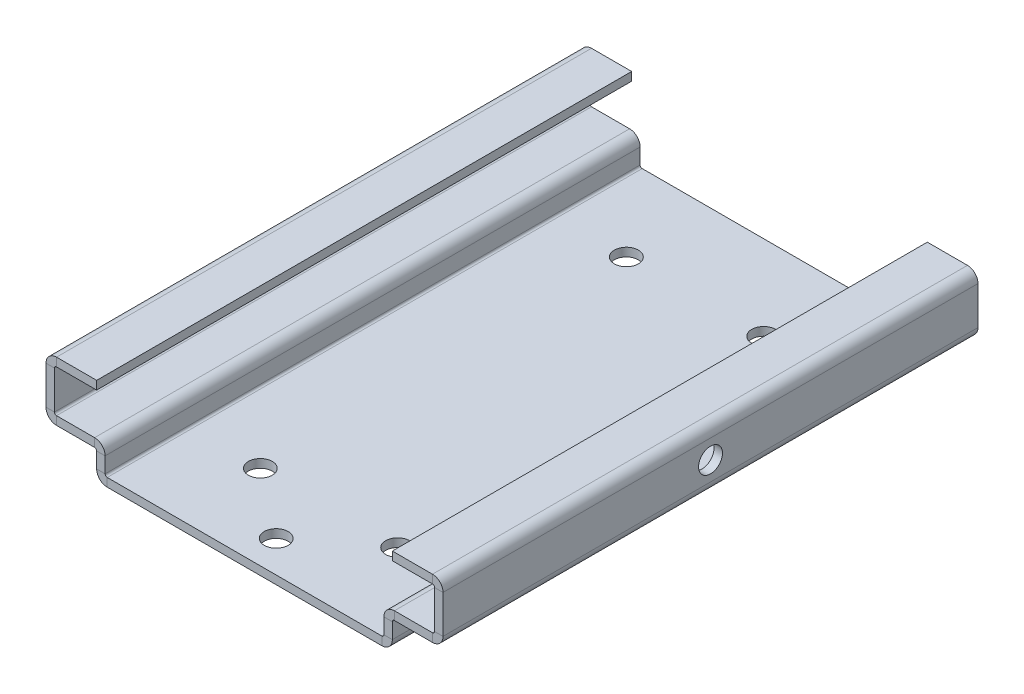
from build123d import *

# Parameters (mm, degrees)
SKETCH1_W                       = 105
SKETCH1_H                       = 190
BASE_FLANGE1_DEPTH              = 3
EDGE_FLANGE1_STRIP_W            = 13.4732
EDGE_FLANGE1_STRIP_H            = 3
EDGE_FLANGE1_STRIP_CUT_DEPTH    = 190
EDGE_FLANGE1_STRIP_2_W          = 13.4732
EDGE_FLANGE1_STRIP_2_H          = 3
EDGE_FLANGE1_STRIP_CUT_2_DEPTH  = 190
EDGE_FLANGE1_DEPTH              = 190
EDGE_FLANGE1_BEND_DEPTH         = 190
SKETCH33_R                      = 4.25
CUT_EXTRUDE1_DEPTH              = 10
EDGE_FLANGE8_STRIP_W            = 13.4732
EDGE_FLANGE8_STRIP_H            = 3
EDGE_FLANGE8_STRIP_CUT_DEPTH    = 190
EDGE_FLANGE8_STRIP_2_W          = 13.4732
EDGE_FLANGE8_STRIP_2_H          = 3
EDGE_FLANGE8_STRIP_CUT_2_DEPTH  = 190
EDGE_FLANGE8_DEPTH              = 190
EDGE_FLANGE8_BEND_DEPTH         = 190
EDGE_FLANGE9_STRIP_W            = 13.4732
EDGE_FLANGE9_STRIP_H            = 3
EDGE_FLANGE9_STRIP_CUT_DEPTH    = 190
EDGE_FLANGE9_STRIP_2_W          = 13.4732
EDGE_FLANGE9_STRIP_2_H          = 3
EDGE_FLANGE9_STRIP_CUT_2_DEPTH  = 190
EDGE_FLANGE9_DEPTH              = 190
EDGE_FLANGE9_BEND_DEPTH         = 190
EDGE_FLANGE10_STRIP_W           = 13.4732
EDGE_FLANGE10_STRIP_H           = 3
EDGE_FLANGE10_STRIP_CUT_DEPTH   = 190
EDGE_FLANGE10_STRIP_2_W         = 13.4732
EDGE_FLANGE10_STRIP_2_H         = 3
EDGE_FLANGE10_STRIP_CUT_2_DEPTH = 190
EDGE_FLANGE10_DEPTH             = 190
EDGE_FLANGE10_BEND_DEPTH        = 190
SKETCH72_R                      = 4.25
CUT_EXTRUDE4_DEPTH              = 10
CUT_EXTRUDE5_START              = -10
SKETCH77_R                      = 4.25
CUT_EXTRUDE5_DEPTH              = 10
SKETCH78_R                      = 4.25
CUT_EXTRUDE8_DEPTH              = 10


# Sheet-metal steps are written as plain solids
with BuildPart() as part:
    # Sketch1 → Base-Flange1 (new body)
    with BuildSketch(Plane(origin=(0, 0, 0), x_dir=(1, 0, 0), z_dir=(0, 1, 0))):
        Rectangle(SKETCH1_W, SKETCH1_H)
    extrude(amount=-BASE_FLANGE1_DEPTH)

    # Edge-Flange1 strip (across the edge) → Edge-Flange1 strip cut (cut)
    with BuildSketch(Plane(origin=(52.5, 0, 95), x_dir=(-1, 0, 0), z_dir=(0, 0, -1))):
        with Locations((-3, -1.5)):
            Rectangle(EDGE_FLANGE1_STRIP_W, EDGE_FLANGE1_STRIP_H)
    extrude(amount=EDGE_FLANGE1_STRIP_CUT_DEPTH, mode=Mode.SUBTRACT)

    # Edge-Flange1 strip 2 (across the edge) → Edge-Flange1 strip cut 2 (cut)
    with BuildSketch(Plane(origin=(-52.5, 0, -95), x_dir=(1, 0, 0), z_dir=(0, 0, 1))):
        with Locations((-3, -1.5)):
            Rectangle(EDGE_FLANGE1_STRIP_2_W, EDGE_FLANGE1_STRIP_2_H)
    extrude(amount=EDGE_FLANGE1_STRIP_CUT_2_DEPTH, mode=Mode.SUBTRACT)

    # Edge-Flange1 section (across the edge) → Edge-Flange1 (add)
    with BuildSketch(Plane(origin=(52.5, 0, 95), x_dir=(-1, 0, 0), z_dir=(0, 0, -1))):
        with BuildLine():
            Line((0, 0.7366), (0, 7))
            Line((0, 7), (3, 7))
            Line((3, 7), (3, 0.7366))
            ThreePointArc((3, 0.7366), (3.215745145, 0.215745145), (3.7366, 0))
            Line((3.7366, 0), (3.7366, -3))
            ThreePointArc((3.7366, -3), (1.094424801, -1.905575199), (0, 0.7366))
        make_face()
    extrude(amount=EDGE_FLANGE1_DEPTH)

    # Edge-Flange1 section 2 (across the edge) → Edge-Flange1 bend (add)
    with BuildSketch(Plane(origin=(-52.5, 0, -95), x_dir=(1, 0, 0), z_dir=(0, 0, 1))):
        with BuildLine():
            Line((0, 0.7366), (0, 7))
            Line((0, 7), (3, 7))
            Line((3, 7), (3, 0.7366))
            ThreePointArc((3, 0.7366), (3.215745145, 0.215745145), (3.7366, 0))
            Line((3.7366, 0), (3.7366, -3))
            ThreePointArc((3.7366, -3), (1.094424801, -1.905575199), (0, 0.7366))
        make_face()
    extrude(amount=EDGE_FLANGE1_BEND_DEPTH)

    # Sketch33 → Cut-Extrude1 (cut)
    with BuildSketch(Plane(origin=(0, 0, 0), x_dir=(1, 0, 0), z_dir=(0, 1, 0))):
        with Locations(Location((24.3834, -65, 0), (0, 0, 270))):
            Circle(SKETCH33_R)
        with Locations(Location((24.3834, 65, 0), (0, 0, 270))):
            Circle(SKETCH33_R)
        with Locations(Location((-24.3834, 65, 0), (0, 0, 270))):
            Circle(SKETCH33_R)
        with Locations(Location((-24.3834, -65, 0), (0, 0, 270))):
            Circle(SKETCH33_R)
    extrude(amount=-CUT_EXTRUDE1_DEPTH, mode=Mode.SUBTRACT)

    # Edge-Flange8 strip (across the edge) → Edge-Flange8 strip cut (cut)
    with BuildSketch(Plane(origin=(-52.5, 7, 95), x_dir=(0, -1, 0), z_dir=(0, 0, -1))):
        with Locations((-6, -1.5)):
            Rectangle(EDGE_FLANGE8_STRIP_W, EDGE_FLANGE8_STRIP_H)
    extrude(amount=EDGE_FLANGE8_STRIP_CUT_DEPTH, mode=Mode.SUBTRACT)

    # Edge-Flange8 strip 2 (across the edge) → Edge-Flange8 strip cut 2 (cut)
    with BuildSketch(Plane(origin=(52.5, 7, -95), x_dir=(0, -1, 0), z_dir=(0, 0, 1))):
        with Locations((-6, -1.5)):
            Rectangle(EDGE_FLANGE8_STRIP_2_W, EDGE_FLANGE8_STRIP_2_H)
    extrude(amount=EDGE_FLANGE8_STRIP_CUT_2_DEPTH, mode=Mode.SUBTRACT)

    # Edge-Flange8 section (across the edge) → Edge-Flange8 (add)
    with BuildSketch(Plane(origin=(-52.5, 7, 95), x_dir=(0, -1, 0), z_dir=(0, 0, -1))):
        with BuildLine():
            Line((-3, 0.7366), (-3, 15))
            Line((-3, 15), (0, 15))
            Line((0, 15), (0, 0.7366))
            ThreePointArc((0, 0.7366), (0.215745145, 0.215745145), (0.7366, 0))
            Line((0.7366, 0), (0.7366, -3))
            ThreePointArc((0.7366, -3), (-1.905575199, -1.905575199), (-3, 0.7366))
        make_face()
    extrude(amount=EDGE_FLANGE8_DEPTH)

    # Edge-Flange8 section 2 (across the edge) → Edge-Flange8 bend (add)
    with BuildSketch(Plane(origin=(52.5, 7, -95), x_dir=(0, -1, 0), z_dir=(0, 0, 1))):
        with BuildLine():
            Line((-3, 0.7366), (-3, 15))
            Line((-3, 15), (0, 15))
            Line((0, 15), (0, 0.7366))
            ThreePointArc((0, 0.7366), (0.215745145, 0.215745145), (0.7366, 0))
            Line((0.7366, 0), (0.7366, -3))
            ThreePointArc((0.7366, -3), (-1.905575199, -1.905575199), (-3, 0.7366))
        make_face()
    extrude(amount=EDGE_FLANGE8_BEND_DEPTH)

    # Edge-Flange9 strip (across the edge) → Edge-Flange9 strip cut (cut)
    with BuildSketch(Plane(origin=(-67.5, 10, -95), x_dir=(1, 0, 0), z_dir=(0, 0, 1))):
        with Locations((-6, -1.5)):
            Rectangle(EDGE_FLANGE9_STRIP_W, EDGE_FLANGE9_STRIP_H)
    extrude(amount=EDGE_FLANGE9_STRIP_CUT_DEPTH, mode=Mode.SUBTRACT)

    # Edge-Flange9 strip 2 (across the edge) → Edge-Flange9 strip cut 2 (cut)
    with BuildSketch(Plane(origin=(67.5, 10, 95), x_dir=(-1, 0, 0), z_dir=(0, 0, -1))):
        with Locations((-6, -1.5)):
            Rectangle(EDGE_FLANGE9_STRIP_2_W, EDGE_FLANGE9_STRIP_2_H)
    extrude(amount=EDGE_FLANGE9_STRIP_CUT_2_DEPTH, mode=Mode.SUBTRACT)

    # Edge-Flange9 section (across the edge) → Edge-Flange9 (add)
    with BuildSketch(Plane(origin=(-67.5, 10, -95), x_dir=(1, 0, 0), z_dir=(0, 0, 1))):
        with BuildLine():
            Line((-3, 0.7366), (-3, 15))
            Line((-3, 15), (0, 15))
            Line((0, 15), (0, 0.7366))
            ThreePointArc((0, 0.7366), (0.215745145, 0.215745145), (0.7366, 0))
            Line((0.7366, 0), (0.7366, -3))
            ThreePointArc((0.7366, -3), (-1.905575199, -1.905575199), (-3, 0.7366))
        make_face()
    extrude(amount=EDGE_FLANGE9_DEPTH)

    # Edge-Flange9 section 2 (across the edge) → Edge-Flange9 bend (add)
    with BuildSketch(Plane(origin=(67.5, 10, 95), x_dir=(-1, 0, 0), z_dir=(0, 0, -1))):
        with BuildLine():
            Line((-3, 0.7366), (-3, 15))
            Line((-3, 15), (0, 15))
            Line((0, 15), (0, 0.7366))
            ThreePointArc((0, 0.7366), (0.215745145, 0.215745145), (0.7366, 0))
            Line((0.7366, 0), (0.7366, -3))
            ThreePointArc((0.7366, -3), (-1.905575199, -1.905575199), (-3, 0.7366))
        make_face()
    extrude(amount=EDGE_FLANGE9_BEND_DEPTH)

    # Edge-Flange10 strip (across the edge) → Edge-Flange10 strip cut (cut)
    with BuildSketch(Plane(origin=(-67.5, 25, -95), x_dir=(0, -1, 0), z_dir=(0, 0, 1))):
        with Locations((-6, -1.5)):
            Rectangle(EDGE_FLANGE10_STRIP_W, EDGE_FLANGE10_STRIP_H)
    extrude(amount=EDGE_FLANGE10_STRIP_CUT_DEPTH, mode=Mode.SUBTRACT)

    # Edge-Flange10 strip 2 (across the edge) → Edge-Flange10 strip cut 2 (cut)
    with BuildSketch(Plane(origin=(67.5, 25, 95), x_dir=(0, -1, 0), z_dir=(0, 0, -1))):
        with Locations((-6, -1.5)):
            Rectangle(EDGE_FLANGE10_STRIP_2_W, EDGE_FLANGE10_STRIP_2_H)
    extrude(amount=EDGE_FLANGE10_STRIP_CUT_2_DEPTH, mode=Mode.SUBTRACT)

    # Edge-Flange10 section (across the edge) → Edge-Flange10 (add)
    with BuildSketch(Plane(origin=(-67.5, 25, -95), x_dir=(0, -1, 0), z_dir=(0, 0, 1))):
        with BuildLine():
            Line((-3, 0.7366), (-3, 15))
            Line((-3, 15), (0, 15))
            Line((0, 15), (0, 0.7366))
            ThreePointArc((0, 0.7366), (0.215745145, 0.215745145), (0.7366, 0))
            Line((0.7366, 0), (0.7366, -3))
            ThreePointArc((0.7366, -3), (-1.905575199, -1.905575199), (-3, 0.7366))
        make_face()
    extrude(amount=EDGE_FLANGE10_DEPTH)

    # Edge-Flange10 section 2 (across the edge) → Edge-Flange10 bend (add)
    with BuildSketch(Plane(origin=(67.5, 25, 95), x_dir=(0, -1, 0), z_dir=(0, 0, -1))):
        with BuildLine():
            Line((-3, 0.7366), (-3, 15))
            Line((-3, 15), (0, 15))
            Line((0, 15), (0, 0.7366))
            ThreePointArc((0, 0.7366), (0.215745145, 0.215745145), (0.7366, 0))
            Line((0.7366, 0), (0.7366, -3))
            ThreePointArc((0.7366, -3), (-1.905575199, -1.905575199), (-3, 0.7366))
        make_face()
    extrude(amount=EDGE_FLANGE10_BEND_DEPTH)

    # Sketch72 → Cut-Extrude4 (cut)
    with BuildSketch(Plane(origin=(70.5, 0, 0), x_dir=(0, 0, -1), z_dir=(1, 0, 0))):
        with Locations(Location((0, 17.5, 0), (0, 0, 90))):
            Circle(SKETCH72_R)
    extrude(amount=-CUT_EXTRUDE4_DEPTH, mode=Mode.SUBTRACT)

    # Sketch77 → Cut-Extrude5 (cut)
    with BuildSketch(Plane.ZY.offset(70.5).offset(CUT_EXTRUDE5_START)):
        with Locations(Location((0, 17.5, 0), (0, 0, 90))):
            Circle(SKETCH77_R)
    extrude(amount=CUT_EXTRUDE5_DEPTH, mode=Mode.SUBTRACT)

    # Sketch78 → Cut-Extrude8 (cut)
    with BuildSketch(Plane(origin=(0, 0, 0), x_dir=(1, 0, 0), z_dir=(0, 1, 0))):
        with Locations(Location((0, -83.75, 0), (0, 0, 270))):
            Circle(SKETCH78_R)
    extrude(amount=-CUT_EXTRUDE8_DEPTH, mode=Mode.SUBTRACT)


solid = part.part
